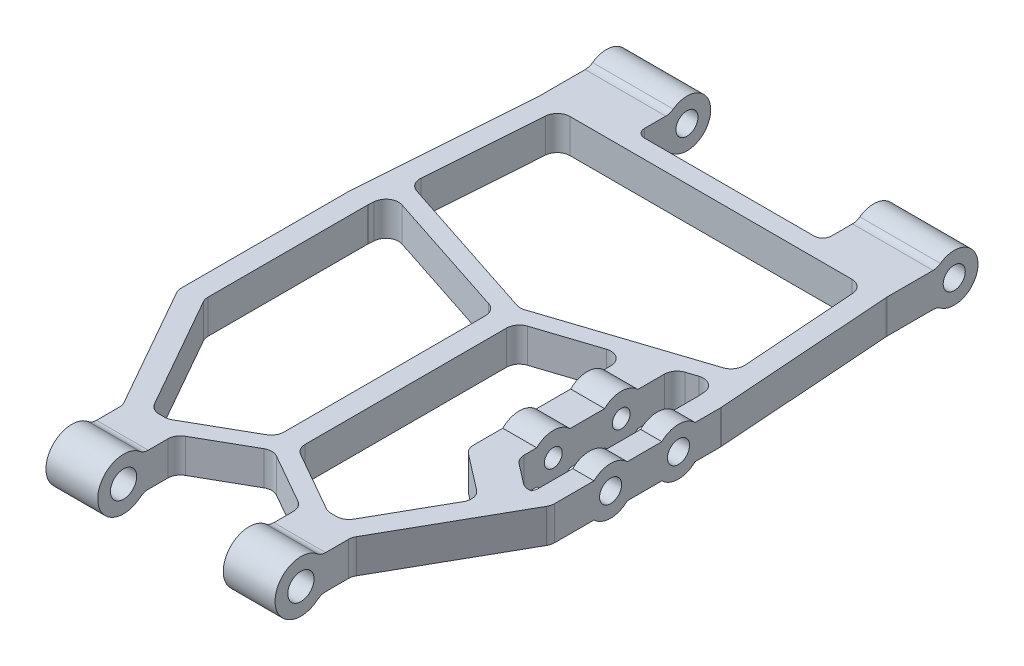
from build123d import *

# Parameters (mm, degrees)
EXTRUDE_1_DEPTH          = 4
FILLET_1_R               = 2
FILLET_2_R               = 4
SKETCH_2_R               = 2.6
CUT_EXTRUDE_1_DEPTH      = 168.263265543
EXTRUDE_3_DEPTH          = 8
EXTRUDE_4_DEPTH          = 8
FILLET_3_R               = 3
FILLET_4_R               = 3
FILLET_5_R               = 3
FILLET_6_R               = 4
CUT_EXTRUDE_2_DEPTH      = 161.601992516
CUT_EXTRUDE_2_DEPTH_BACK = 161.601992516
SKETCH_5_R               = 3.1
EXTRUDE_5_DEPTH          = 12.2
EXTRUDE_START            = -12.2
EXTRUDE_6_DEPTH          = 12.2
FILLET_7_R               = 3
SKETCH_8_R               = 2.6
CUT_EXTRUDE_3_DEPTH      = 8
SKETCH_9_R               = 5.6
SKETCH_9_R_2             = 2.6
EXTRUDE_7_DEPTH          = 8
SKETCH_10_R              = 5.6
SKETCH_10_R_2            = 2.6
EXTRUDE_8_DEPTH          = 5
SKETCH_11_R              = 2
CUT_EXTRUDE_4_DEPTH      = 8
HOLE_WIZARD_M5_2_D       = 4.2
HOLE_WIZARD_M5_2_DEPTH   = 12.4
HOLE_WIZARD_M5_2_TIP     = 1.2618073
SKETCH_15_R              = 5.6
SKETCH_15_R_2            = 2.6
EXTRUDE_9_DEPTH          = 19
EXTRUDE_START_2          = -19
SKETCH_16_R              = 5.6
SKETCH_16_R_2            = 2.6
EXTRUDE_10_DEPTH         = 19
FILLET_8_R               = 3


# Some blends are built 0.0001 mm under size
with BuildPart() as part:
    # 草图1 → 凸台-拉伸1 (new, symmetric)
    with BuildSketch(Plane(origin=(0, 0, 0), x_dir=(1, 0, 0), z_dir=(0, 1, 0))):
        with BuildLine():
            Line((-22, 4), (-41, 4))
            Line((-41, 4), (-41, 0))
            Line((-41, 0), (-41, -15.892993457))
            ThreePointArc((-41, -15.892993457), (-41.001906581, -15.999931994), (-41.007623901, -16.106734607))
            Line((-41.007623901, -16.106734607), (-43.992376099, -57.893265393))
            ThreePointArc((-43.992376099, -57.893265393), (-43.998093419, -58.000068006), (-44, -58.107006543))
            Line((-44, -58.107006543), (-44, -97.209080124))
            ThreePointArc((-44, -97.209080124), (-43.900879149, -97.973867783), (-43.610066558, -98.68811784))
            Line((-43.610066558, -98.68811784), (-27.389933442, -127.31188216))
            ThreePointArc((-27.389933442, -127.31188216), (-27.099120851, -128.026132217), (-27, -128.790919876))
            Line((-27, -128.790919876), (-27, -140))
            Line((-27, -140), (-27, -141))
            Line((-27, -141), (-27, -144))
            Line((-27, -144), (-24, -144))
            Line((-24, -144), (-14.8, -144))
            Line((-14.8, -144), (-14.8, -125.53493714))
            Line((-14.8, -125.53493714), (-20.901701141, -125.53493714))
            ThreePointArc((-20.901701141, -125.53493714), (-22.412145918, -125.126954998), (-23.511767698, -124.013974856))
            Line((-23.511767698, -124.013974856), (-38.610066558, -97.369918046))
            ThreePointArc((-38.610066558, -97.369918046), (-38.900879149, -96.655667989), (-39, -95.89088033))
            Line((-39, -95.89088033), (-39, -58.285350781))
            ThreePointArc((-39, -58.285350781), (-38.998093419, -58.178412244), (-38.992376099, -58.071609631))
            Line((-38.992376099, -58.071609631), (-36.21172499, -19.1424941))
            ThreePointArc((-36.21172499, -19.1424941), (-35.263704113, -17.160646098), (-33.219348891, -16.35623525))
            Line((-33.219348891, -16.35623525), (33.219348891, -16.35623525))
            ThreePointArc((33.219348891, -16.35623525), (35.263704113, -17.160646098), (36.21172499, -19.1424941))
            Line((36.21172499, -19.1424941), (38.992376099, -58.071609631))
            ThreePointArc((38.992376099, -58.071609631), (38.998093419, -58.178412244), (39, -58.285350781))
            Line((39, -58.285350781), (39, -95.89088033))
            ThreePointArc((39, -95.89088033), (38.900879149, -96.655667989), (38.610066558, -97.369918046))
            Line((38.610066558, -97.369918046), (23.511767698, -124.013974856))
            ThreePointArc((23.511767698, -124.013974856), (22.412145918, -125.126954998), (20.901701141, -125.53493714))
            Line((20.901701141, -125.53493714), (14.8, -125.53493714))
            Line((14.8, -125.53493714), (14.8, -144))
            Line((14.8, -144), (24, -144))
            Line((24, -144), (27, -144))
            Line((27, -144), (27, -141))
            Line((27, -141), (27, -140))
            Line((27, -140), (27, -128.790919876))
            ThreePointArc((27, -128.790919876), (27.099120851, -128.026132217), (27.389933442, -127.31188216))
            Line((27.389933442, -127.31188216), (43.610066558, -98.68811784))
            ThreePointArc((43.610066558, -98.68811784), (43.900879149, -97.973867783), (44, -97.209080124))
            Line((44, -97.209080124), (44, -58.107006543))
            ThreePointArc((44, -58.107006543), (43.998093419, -58.000068006), (43.992376099, -57.893265393))
            Line((43.992376099, -57.893265393), (41.007623901, -16.106734607))
            ThreePointArc((41.007623901, -16.106734607), (41.001906581, -15.999931994), (41, -15.892993457))
            Line((41, -15.892993457), (41, 0))
            Line((41, 0), (41, 4))
            Line((41, 4), (22, 4))
            Line((22, 4), (22, -12))
            Line((22, -12), (-22, -12))
            Line((-22, -12), (-22, 4))
        make_face()
    extrude(amount=EXTRUDE_1_DEPTH, both=True)

    # 圆角1
    fillet_1_edges = [part.edges().sort_by_distance(p)[0] for p in [
        (-22, 0, 12),
        (22, 0, 12),
    ]]
    fillet(fillet_1_edges, radius=FILLET_1_R)

    # 圆角2
    fillet_2_edges = [part.edges().sort_by_distance(p)[0] for p in [
        (-31.5, -4, -4),
        (-31.5, 4, -4),
        (31.5, -4, -4),
        (31.5, 4, -4),
    ]]
    fillet(fillet_2_edges, radius=FILLET_2_R - 0.0001)  # a hair under: the kernel refuses the full size

    # 草图2 → 切除-拉伸1 (cut, through all)
    with BuildSketch(Plane(origin=(41, 0, 0), x_dir=(0, 0, -1), z_dir=(1, 0, 0))):
        Circle(SKETCH_2_R)
    extrude(amount=-CUT_EXTRUDE_1_DEPTH, mode=Mode.SUBTRACT)

    # 草图3 → 凸台-拉伸3 (add)
    with BuildSketch(Plane(origin=(0, 4, 0), x_dir=(1, 0, 0), z_dir=(0, 1, 0))):
        Polygon((-14.8, -125.53493714), (0, -117.108976983), (14.8, -125.53493714), (18.842380129, -125.53493714), (2.5, -116.230866611), (2.5, -64.839425262), (38.630436585, -53.004456422), (38.336658254, -48.891559789), (0, -61.449203669), (-38.336658254, -48.891559789), (-38.630436585, -53.004456422), (-2.5, -64.839425262), (-2.5, -116.230866611), (-18.842380129, -125.53493714), align=None)
        Polygon((14.8, -125.53493714), (0, -117.108976983), (-14.8, -125.53493714), (-14.8, -127.836351593), (0, -119.410391436), (14.8, -127.836351593), align=None)
    extrude(amount=-EXTRUDE_3_DEPTH)

    # 草图4 → 凸台-拉伸4 (add)
    with BuildSketch(Plane(origin=(0, 4, 0), x_dir=(1, 0, 0), z_dir=(0, 1, 0))):
        Polygon((22.5, -58.288179299), (22.5, -96.281444507), (34.142811775, -105.253308839), (38.126447018, -98.223364291), (30.5, -92.346480828), (30.5, -55.667680914), align=None)
    extrude(amount=-EXTRUDE_4_DEPTH)

    # 圆角3
    # the kernel refuses this fillet: 3 mm, written as the material it adds along each edge
    with BuildSketch(Plane(origin=(2.5, 4, 116.230866611), x_dir=(0.8690307812892697, 0, 0.4947580228472919), z_dir=(0, -1, 0)), Plane(origin=(-2.5, 4, 116.230866611), x_dir=(0, 0, -1), z_dir=(0, -1, 0))) as fillet_3_piece_1:
        with BuildLine():
            CenterArc((FILLET_3_R * 0.581385594194, -FILLET_3_R), FILLET_3_R, 90, 60.346204643)
            Line((-FILLET_3_R * 0.287645187095, -FILLET_3_R * 0.505241977153), (0, 0))
            Line((0, 0), (FILLET_3_R * 0.581385594194, 0))
        make_face()
    extrude(amount=8)
    with BuildSketch(Plane(origin=(2.5, 4, 64.839425262), x_dir=(0, 0, 1), z_dir=(0, -1, 0)), Plane(origin=(-2.5, 4, 64.839425262), x_dir=(-0.9503157493032816, 0, -0.3112876107816409), z_dir=(0, -1, 0))) as fillet_3_piece_2:
        with BuildLine():
            CenterArc((FILLET_3_R * 0.724719536347, -FILLET_3_R), FILLET_3_R, 90, 71.863154967)
            Line((-FILLET_3_R * 0.225596212956, -FILLET_3_R * 0.688712389218), (0, 0))
            Line((0, 0), (FILLET_3_R * 0.724719536347, 0))
        make_face()
    extrude(amount=8)
    with BuildSketch(Plane(origin=(38.630436585, 4, 53.004456422), x_dir=(-0.950315749303283, 0, 0.31128761078163697), z_dir=(0, -1, 0)), Plane(origin=(-38.630436585, 4, 53.004456422), x_dir=(-0.07124704998791004, 0, 0.9974586998307349), z_dir=(0, -1, 0))) as fillet_3_piece_3:
        with BuildLine():
            CenterArc((FILLET_3_R * 1.28112173967, -FILLET_3_R), FILLET_3_R, 90, 104.051228253)
            Line((FILLET_3_R * 0.311042703978, -FILLET_3_R * 1.24278934183), (0, 0))
            Line((0, 0), (FILLET_3_R * 1.28112173967, 0))
        make_face()
    extrude(amount=8)
    with BuildSketch(Plane(origin=(38.336658254, 4, 48.891559789), x_dir=(-0.07124704998790986, 0, -0.997458699830735), z_dir=(0, -1, 0)), Plane(origin=(-38.336658254, 4, 48.891559789), x_dir=(0.9503157493032821, 0, 0.31128761078163925), z_dir=(0, -1, 0))) as fillet_3_piece_4:
        with BuildLine():
            CenterArc((FILLET_3_R * 0.780565943917, -FILLET_3_R), FILLET_3_R, 90, 75.948771747)
            Line((-FILLET_3_R * 0.189513091778, -FILLET_3_R * 0.757210658171), (0, 0))
            Line((0, 0), (FILLET_3_R * 0.780565943917, 0))
        make_face()
    extrude(amount=8)
    with BuildSketch(Plane(origin=(0, 4, 61.449203669), x_dir=(0.950315749303282, 0, -0.31128761078163986), z_dir=(0, -1, 0))) as fillet_3_piece_5:
        with BuildLine():
            CenterArc((FILLET_3_R * 0.32756229812, -FILLET_3_R), FILLET_3_R, 90, 36.273690066)
            Line((-FILLET_3_R * 0.264080740057, -FILLET_3_R * 0.193799953252), (0, 0))
            Line((0, 0), (FILLET_3_R * 0.32756229812, 0))
        make_face()
    extrude(amount=8)
    with BuildSketch(Plane(origin=(34.142811775, 4, 105.253308839), x_dir=(-0.4930125719808814, 0, 0.8700221858486117), z_dir=(0, -1, 0))) as fillet_3_piece_6:
        with BuildLine():
            CenterArc((FILLET_3_R * 0.868080201224, FILLET_3_R), FILLET_3_R, 188.078797476, 81.921202524)
            Line((-FILLET_3_R * 0.121995529748, FILLET_3_R * 0.859465139769), (0, 0))
            Line((0, 0), (FILLET_3_R * 0.868080201224, 0))
        make_face()
    extrude(amount=8)
    with BuildSketch(Plane(origin=(22.5, 4, 58.288179299), x_dir=(-0.9503157493032814, 0, 0.31128761078164163), z_dir=(0, -1, 0))) as fillet_3_piece_7:
        with BuildLine():
            CenterArc((FILLET_3_R * 1.37984413259, -FILLET_3_R), FILLET_3_R, 90, 108.136845033)
            Line((FILLET_3_R * 0.429528383284, -FILLET_3_R * 1.31128761078), (0, 0))
            Line((0, 0), (FILLET_3_R * 1.37984413259, 0))
        make_face()
    extrude(amount=8)
    with BuildSketch(Plane(origin=(30.5, 4, 55.667680914), x_dir=(0.9503157493032841, 0, -0.31128761078163375), z_dir=(0, -1, 0))) as fillet_3_piece_8:
        with BuildLine():
            CenterArc((FILLET_3_R * 0.724719536347, FILLET_3_R), FILLET_3_R, 198.136845033, 71.863154967)
            Line((-FILLET_3_R * 0.225596212956, FILLET_3_R * 0.688712389218), (0, 0))
            Line((0, 0), (FILLET_3_R * 0.724719536347, 0))
        make_face()
    extrude(amount=8)
    with BuildSketch(Plane(origin=(30.5, 4, 92.346480828), x_dir=(0.7921023987207179, 0, 0.6103882288682219), z_dir=(0, -1, 0))) as fillet_3_piece_9:
        with BuildLine():
            CenterArc((FILLET_3_R * 0.491870459881, -FILLET_3_R), FILLET_3_R, 90, 52.382420264)
            Line((-FILLET_3_R * 0.300231938839, -FILLET_3_R * 0.389611771132), (0, 0))
            Line((0, 0), (FILLET_3_R * 0.491870459881, 0))
        make_face()
    extrude(amount=8)
    with BuildSketch(Plane(origin=(38.126447018, 4, 98.223364291), x_dir=(0.4930125719808763, 0, -0.8700221858486146), z_dir=(0, -1, 0))) as fillet_3_piece_10:
        with BuildLine():
            CenterArc((3.300180493, -1.902934356), FILLET_3_R, 140.631065157, 47.44773232)
            Line((0.3299533, -2.324538937), (0, 0))
            Line((0, 0), (0.980947681, 0))
        make_face()
    extrude(amount=8)
    # the kernel refuses this fillet: 3 mm, written as the material it takes off along each edge
    with BuildSketch(Plane(origin=(22.5, 7.689028449, 96.281444507), x_dir=(0, 0, -1), z_dir=(0, -1, 0))) as fillet_3_2_piece_1:
        with BuildLine():
            CenterArc((FILLET_3_R * 0.491870459881, FILLET_3_R), FILLET_3_R, 217.617579736, 52.382420264)
            Line((-FILLET_3_R * 0.300231938839, FILLET_3_R * 0.389611771132), (0, 0))
            Line((0, 0), (FILLET_3_R * 0.491870459881, 0))
        make_face()
    extrude(amount=15.378056898, mode=Mode.SUBTRACT)

    # 圆角4
    fillet_4_edges = [part.edges().sort_by_distance(p)[0] for p in [
        (-14.8, 0, 127.836351593),
        (0, 0, 119.410391436),
        (14.8, 0, 127.836351593),
    ]]
    fillet(fillet_4_edges, radius=FILLET_4_R)

    # 圆角5
    fillet_5_edges = [part.edges().sort_by_distance(p)[0] for p in [
        (18.842380129, 0, 125.53493714),
        (-18.842380129, 0, 125.53493714),
    ]]
    fillet(fillet_5_edges, radius=FILLET_5_R)

    # 圆角6
    fillet_6_edges = [part.edges().sort_by_distance(p)[0] for p in [
        (20.9, -4, 144),
        (20.9, 4, 144),
        (-20.9, -4, 144),
        (-20.9, 4, 144),
    ]]
    fillet(fillet_6_edges, radius=FILLET_6_R - 0.0001)  # a hair under: the kernel refuses the full size

    # 草图5 → 切除-拉伸2 (cut, two sides: drawn at the far end of the back side and taken through both)
    with BuildSketch(Plane(origin=(27, 0, 0), x_dir=(0, 0, -1), z_dir=(1, 0, 0)).offset(-CUT_EXTRUDE_2_DEPTH_BACK)):
        with Locations((-140, 0)):
            Circle(SKETCH_5_R)
    extrude(amount=CUT_EXTRUDE_2_DEPTH + CUT_EXTRUDE_2_DEPTH_BACK, mode=Mode.SUBTRACT)

    # 草图6 → 凸台-拉伸5 (add)
    with BuildSketch(Plane(origin=(27, 0, 0), x_dir=(0, 0, -1), z_dir=(1, 0, 0))):
        with BuildLine():
            Line((-140, 4), (-135.394568424, 4))
            ThreePointArc((-135.394568424, 4), (-146.1, 0), (-135.394568424, -4))
            Line((-135.394568424, -4), (-140, -4))
            ThreePointArc((-140, -4), (-142.828427125, -2.828427125), (-144, 0))
            ThreePointArc((-144, 0), (-142.828427125, 2.828427125), (-140, 4))
        make_face()
    extrude(amount=-EXTRUDE_5_DEPTH)

    # 草图7 → 凸台-拉伸6 (add)
    with BuildSketch(Plane.ZY.offset(27).offset(EXTRUDE_START)):
        with BuildLine():
            ThreePointArc((135.394568424, -4), (142.135048874, -5.714154907), (146.1, 0))
            ThreePointArc((146.1, 0), (142.135048874, 5.714154907), (135.394568424, 4))
            Line((135.394568424, 4), (140, 4))
            ThreePointArc((140, 4), (142.828427125, 2.828427125), (144, 0))
            ThreePointArc((144, 0), (142.828427125, -2.828427125), (140, -4))
            Line((140, -4), (135.394568424, -4))
        make_face()
    extrude(amount=EXTRUDE_6_DEPTH)

    # 圆角7
    fillet_7_edges = [part.edges().sort_by_distance(p)[0] for p in [
        (20.9, 4, 135.394568424),
        (20.9, -4, 135.394568424),
        (-20.9, -4, 135.394568424),
        (-20.9, 4, 135.394568424),
    ]]
    fillet(fillet_7_edges, radius=FILLET_7_R)

    # 草图8 → 切除-拉伸3 (cut)
    with BuildSketch(Plane(origin=(44, 0, 0), x_dir=(0, 0, -1), z_dir=(1, 0, 0))):
        with Locations((-68, 0)):
            Circle(SKETCH_8_R)
        with Locations((-84, 0)):
            Circle(SKETCH_8_R)
    extrude(amount=-CUT_EXTRUDE_3_DEPTH, mode=Mode.SUBTRACT)

    # 草图9 → 凸台-拉伸7 (add)
    # profile 1 of 2: a face of its own
    with BuildSketch(Plane(origin=(30.5, 0, 0), x_dir=(0, 0, -1), z_dir=(1, 0, 0))):
        with Locations((-68, 0)):
            Circle(SKETCH_9_R)
        with Locations((-68, 0)):
            Circle(SKETCH_9_R_2, mode=Mode.SUBTRACT)
    # profile 2 of 2: a face of its own
    with BuildSketch(Plane(origin=(30.5, 0, 0), x_dir=(0, 0, -1), z_dir=(1, 0, 0))):
        with Locations((-84, 0)):
            Circle(SKETCH_9_R)
        with Locations((-84, 0)):
            Circle(SKETCH_9_R_2, mode=Mode.SUBTRACT)
    extrude(amount=-EXTRUDE_7_DEPTH)

    # 草图10 → 凸台-拉伸8 (add)
    # profile 1 of 2: a face of its own
    with BuildSketch(Plane(origin=(44, 0, 0), x_dir=(0, 0, -1), z_dir=(1, 0, 0))):
        with Locations((-84, 0)):
            Circle(SKETCH_10_R)
        with Locations((-84, 0)):
            Circle(SKETCH_10_R_2, mode=Mode.SUBTRACT)
    # profile 2 of 2: a face of its own
    with BuildSketch(Plane(origin=(44, 0, 0), x_dir=(0, 0, -1), z_dir=(1, 0, 0))):
        with Locations((-68, 0)):
            Circle(SKETCH_10_R)
        with Locations((-68, 0)):
            Circle(SKETCH_10_R_2, mode=Mode.SUBTRACT)
    extrude(amount=-EXTRUDE_8_DEPTH)

    # 草图11 → 切除-拉伸4 (cut)
    with BuildSketch(Plane(origin=(30.5, 0, 0), x_dir=(0, 0, -1), z_dir=(1, 0, 0))):
        with Locations((-84, 0)):
            Circle(SKETCH_11_R)
        with Locations((-68, 0)):
            Circle(SKETCH_11_R)
    extrude(amount=-CUT_EXTRUDE_4_DEPTH, mode=Mode.SUBTRACT)

    # M5 螺纹孔2
    with Locations(Plane(origin=(30.5, 0, 84), x_dir=(0, 0, 1), z_dir=(1, 0, 0))):
        with Locations((0, 0), (-16, 0)):
            Hole(HOLE_WIZARD_M5_2_D / 2, depth=HOLE_WIZARD_M5_2_DEPTH)
            with Locations((0, 0, -(HOLE_WIZARD_M5_2_DEPTH + HOLE_WIZARD_M5_2_TIP / 2))):  # 118° drill point
                Cone(0, HOLE_WIZARD_M5_2_D / 2, HOLE_WIZARD_M5_2_TIP, mode=Mode.SUBTRACT)

    # 草图15 → 凸台-拉伸9 (add)
    with BuildSketch(Plane(origin=(41, 0, 0), x_dir=(0, 0, -1), z_dir=(1, 0, 0))):
        Circle(SKETCH_15_R)
        Circle(SKETCH_15_R_2, mode=Mode.SUBTRACT)
    extrude(amount=-EXTRUDE_9_DEPTH)

    # 草图16 → 凸台-拉伸10 (add)
    with BuildSketch(Plane.ZY.offset(41).offset(EXTRUDE_START_2)):
        Circle(SKETCH_16_R)
        with Locations(Location((0, 0, 0), (0, 0, 180))):
            Circle(SKETCH_16_R_2, mode=Mode.SUBTRACT)
    extrude(amount=EXTRUDE_10_DEPTH)

    # 圆角8
    fillet_8_edges = [part.edges().sort_by_distance(p)[0] for p in [
        (31.5, -4, 3.919183588),
        (31.5, 4, 3.919183588),
        (-31.5, -4, 3.919183588),
        (-31.5, 4, 3.919183588),
    ]]
    fillet(fillet_8_edges, radius=FILLET_8_R)


solid = part.part
